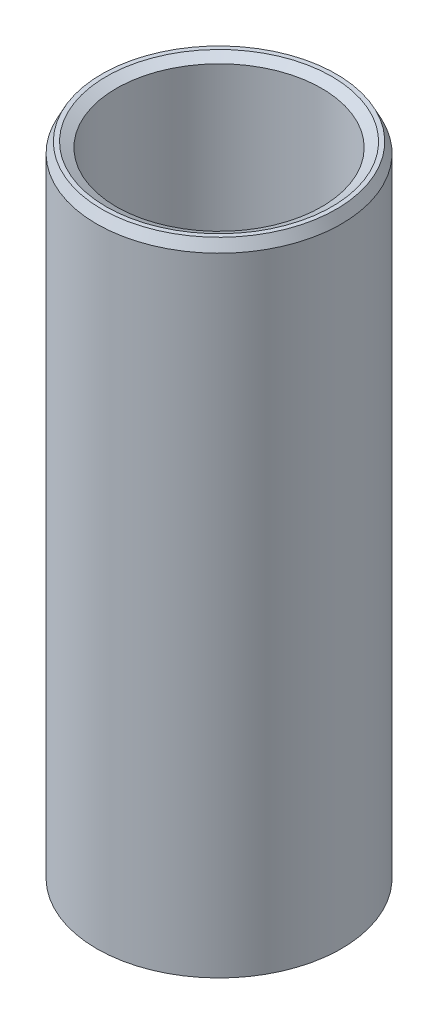
from build123d import *
from OCP.BRepFilletAPI import BRepFilletAPI_MakeChamfer

# Parameters (mm, degrees)
SKETCH1_R           = 22.5
BOSS_EXTRUDE1_DEPTH = 118.256648868
SKETCH2_R           = 18.877473169
CUT_EXTRUDE1_DEPTH  = 123.462790273
CHAMFER1_SIZE       = 1.874237874
CHAMFER1_SIZE2      = 0.947082952


with BuildPart() as part:
    # Sketch1 → Boss-Extrude1 (new body)
    with BuildSketch(Plane(origin=(0, 0, 0), x_dir=(1, 0, 0), z_dir=(0, 1, 0))):
        Circle(SKETCH1_R)
    extrude(amount=BOSS_EXTRUDE1_DEPTH)

    # Sketch2 → Cut-Extrude1 (cut, through all)
    with BuildSketch(Plane(origin=(0, 0, 0), x_dir=(1, 0, 0), z_dir=(0, 1, 0))):
        Circle(SKETCH2_R)
    extrude(amount=CUT_EXTRUDE1_DEPTH, mode=Mode.SUBTRACT)

    # Chamfer1: one chamfer whose edges measure the first distance from different faces: ONE call of the kernel's chamfer builder (chamfer() names one face for all edges)
    chamfer1_edges_1 = [part.edges().sort_by_distance(p)[0] for p in [
        (-18.877473169, 118.256648868, 0),
    ]]
    chamfer1_side_1 = [part.faces().sort_by_distance(p)[0] for p in [
        (-21.863603897, 118.256648868, 0),
    ]]
    chamfer1_edges_2 = [part.edges().sort_by_distance(p)[0] for p in [
        (-18.877473169, 0, 0),
    ]]
    chamfer1_side_2 = [part.faces().sort_by_distance(p)[0] for p in [
        (-18.877473169, 59.128324434, 0),
    ]]
    chamfer1_edges_3 = [part.edges().sort_by_distance(p)[0] for p in [
        (-22.5, 0, 0),
    ]]
    chamfer1_side_3 = [part.faces().sort_by_distance(p)[0] for p in [
        (-21.863603897, 0, 0),
    ]]
    chamfer1_edges_4 = [part.edges().sort_by_distance(p)[0] for p in [
        (-22.5, 118.256648868, 0),
    ]]
    chamfer1_side_4 = [part.faces().sort_by_distance(p)[0] for p in [
        (-22.5, 59.128324434, 0),
    ]]
    chamfer1 = BRepFilletAPI_MakeChamfer(part.part.solid().wrapped)
    for e in chamfer1_edges_1:
        chamfer1.Add(CHAMFER1_SIZE, CHAMFER1_SIZE2, e.wrapped, chamfer1_side_1[0].wrapped)  # the first distance lies on this face
    for e in chamfer1_edges_2:
        chamfer1.Add(CHAMFER1_SIZE, CHAMFER1_SIZE2, e.wrapped, chamfer1_side_2[0].wrapped)  # the first distance lies on this face
    for e in chamfer1_edges_3:
        chamfer1.Add(CHAMFER1_SIZE, CHAMFER1_SIZE2, e.wrapped, chamfer1_side_3[0].wrapped)  # the first distance lies on this face
    for e in chamfer1_edges_4:
        chamfer1.Add(CHAMFER1_SIZE, CHAMFER1_SIZE2, e.wrapped, chamfer1_side_4[0].wrapped)  # the first distance lies on this face
    add(Compound.cast(chamfer1.Shape()), mode=Mode.REPLACE)


solid = part.part
